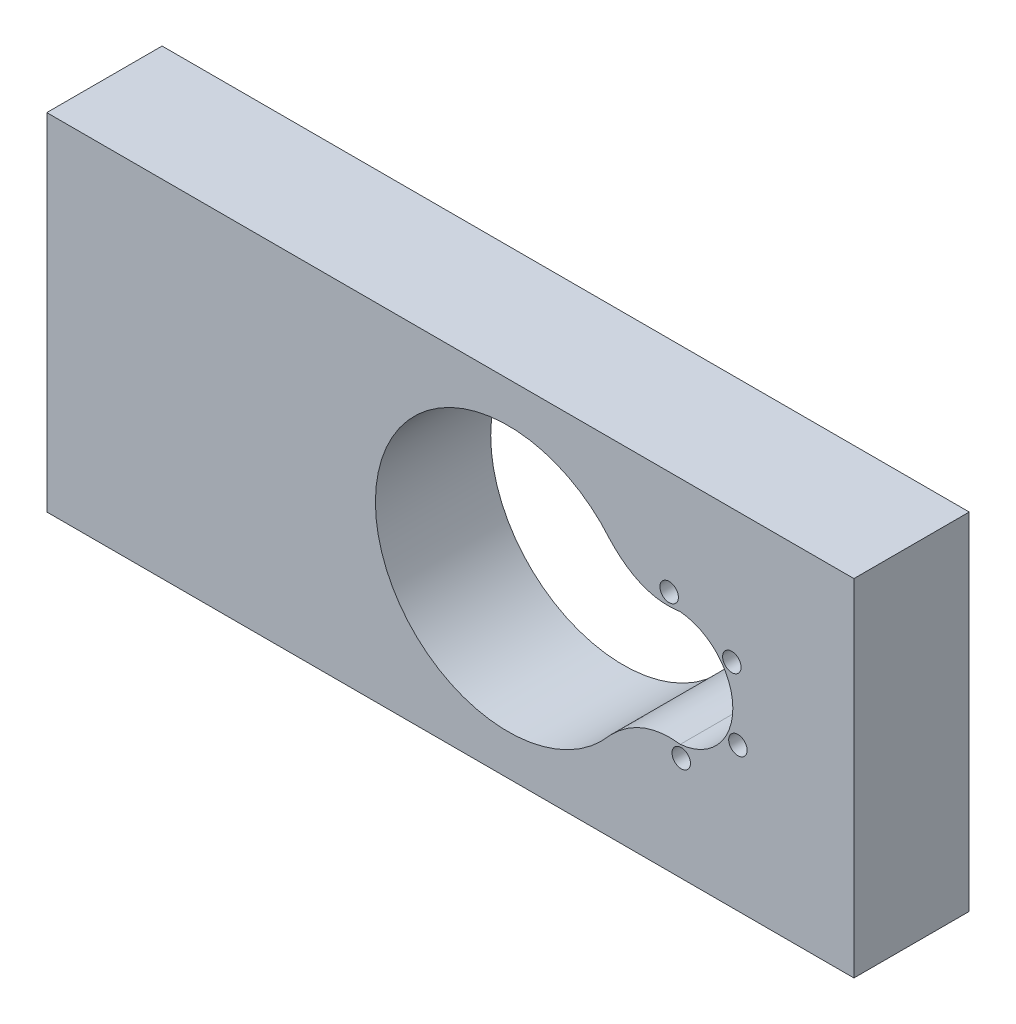
from build123d import *

# Parameters (mm, degrees)
ESQUISSE1_W             = 70
ESQUISSE1_H             = 30
BOSS_EXTRU_1_DEPTH      = 10
ESQUISSE2_R             = 0.8
ENL_V_MAT_EXTRU_1_DEPTH = 77.811457479


with BuildPart() as part:
    # Esquisse1 → Boss.-Extru.1 (new body)
    with BuildSketch(Plane.XY):
        with Locations((35, 15)):
            Rectangle(ESQUISSE1_W, ESQUISSE1_H)
    extrude(amount=BOSS_EXTRU_1_DEPTH)

    # Esquisse2 → Enlèv. mat.-Extru.1 (cut, through all)
    with BuildSketch(Plane.XY.offset(10)):
        with Locations((53.974554028, 20.976947928)):
            Circle(ESQUISSE2_R)
        with Locations((59.413465757, 18.443523524)):
            Circle(ESQUISSE2_R)
        with Locations((59.938911728, 12.466575596)):
            Circle(ESQUISSE2_R)
        with Locations((55.025445972, 9.023052072)):
            Circle(ESQUISSE2_R)
        with BuildLine():
            ThreePointArc((54.940833126, 19.980528702), (59.5, 15), (54.940833126, 10.019471298))
            add(Edge.make_bspline(
                [(48.86, 7.668533571), (51.540343022, 10.446024006), (54.940833126, 10.019471298)],
                knots=[0, 0, 0, 1, 1, 1], degree=2))
            ThreePointArc((48.86, 7.668533571), (28.5, 15), (48.86, 22.331466429))
            add(Edge.make_bspline(
                [(48.86, 22.331466429), (51.534478996, 19.459310032), (54.940833126, 19.980528702)],
                knots=[0, 0, 0, 1, 1, 1], degree=2))
        make_face()
    extrude(amount=-ENL_V_MAT_EXTRU_1_DEPTH, mode=Mode.SUBTRACT)


solid = part.part
